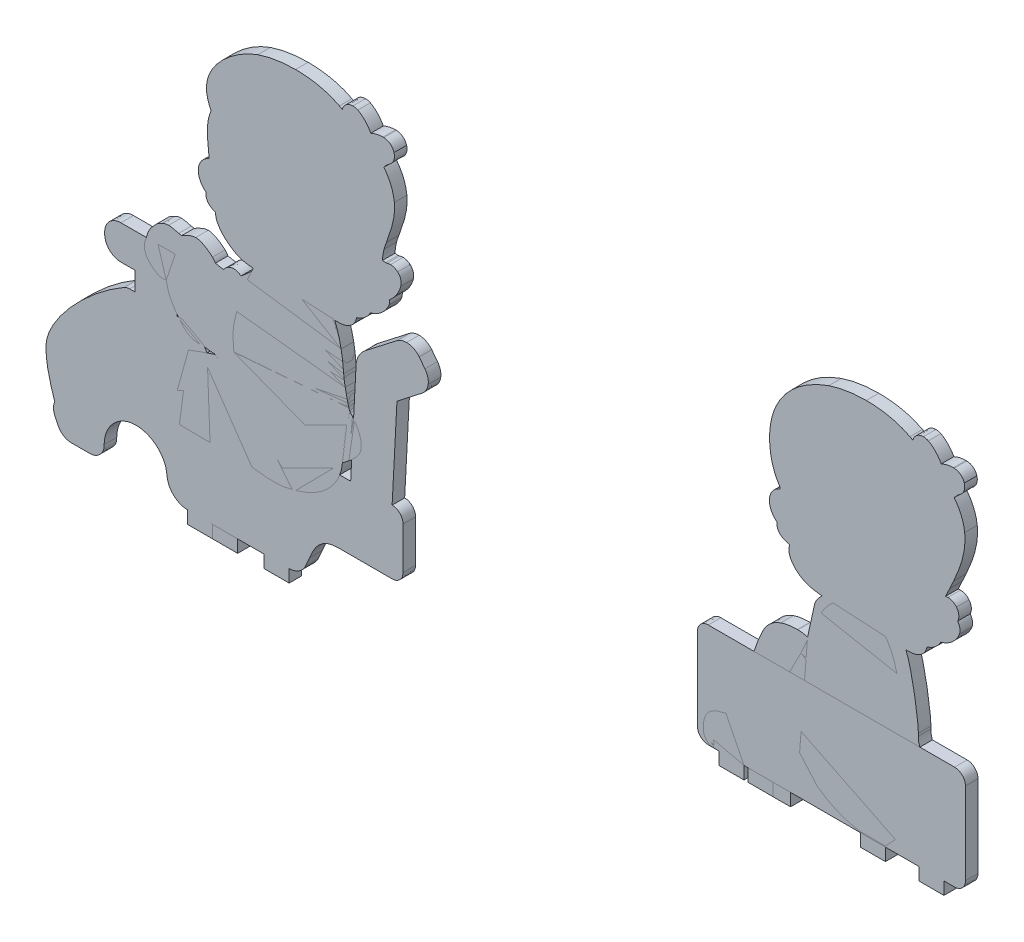
from build123d import *

# Parameters (mm, degrees)
D_TORSO_DEPTH = 2.3
SKETCH10_W    = 4.6
SKETCH10_H    = 2.3
TAB1_DEPTH    = 2.3
D_SIDE_DEPTH  = 2.3
SKETCH15_W    = 4.6
SKETCH15_H    = 2.3
TAB2_DEPTH    = 2.3
M_TORSO_DEPTH = 2.3
SKETCH20_W    = 4.6
SKETCH20_H    = 3.585827138
SKETCH20_H_2  = 2.717243782
TAB3_DEPTH    = 2.3
BOX_DEPTH     = 2.3
SKETCH25_W    = 4.6
SKETCH25_H    = 2.3
TAB4_DEPTH    = 2.3
M_ARM_DEPTH   = 2.3
SKETCH30_W    = 3.45
SKETCH30_H    = 2.3
TAB5_DEPTH    = 2.3


# Sheet-metal steps are written as plain solids
with BuildPart() as part:
    # d-torso: sheet metal written as solids
    # D-middle-laser → d-torso (new body)
    with BuildSketch(Plane.XY):
        with BuildLine():
            Line((303.416944809, -362.651679732), (302.356630546, -361.283503124))
            add(Edge.make_bspline(
                [(302.356630546, -361.283503124), (301.798654269, -360.563478168), (300.956845187, -360.15054041), (300.047081597, -360.15054041)],
                knots=[1, 1, 1, 1, 2, 2, 2, 2], degree=3))
            add(Edge.make_bspline(
                [(300.047081597, -360.15054041), (299.403322442, -360.15054041), (298.768154493, -360.368205849), (298.258560276, -360.763487493)],
                knots=[2, 2, 2, 2, 3, 3, 3, 3], degree=3))
            Line((298.258560276, -360.763487493), (292.42928646, -365.285627486))
            add(Edge.make_bspline(
                [(292.42928646, -365.285627486), (291.461537606, -366.036399919), (290.869670202, -367.16931957), (290.805419171, -368.393964887)],
                knots=[4, 4, 4, 4, 5, 5, 5, 5], degree=3))
            Line((290.805419171, -368.393964887), (290.348577978, -377.102046618))
            add(Edge.make_bspline(
                [(290.348577978, -377.102046618), (290.156212459, -376.850985284), (289.960229589, -376.627140205), (289.771955121, -376.43877961)],
                knots=[6, 6, 6, 6, 7, 7, 7, 7], degree=3))
            add(Edge.make_bspline(
                [(289.771955121, -376.43877961), (289.498586794, -376.131089519), (289.211976382, -374.765023032), (289.022302343, -373.861029977)],
                knots=[7, 7, 7, 7, 8, 8, 8, 8], degree=3))
            add(Edge.make_bspline(
                [(289.022302343, -373.861029977), (288.955510555, -373.542573963), (288.887405323, -373.21830435), (288.814412363, -372.892872018)],
                knots=[8, 8, 8, 8, 9, 9, 9, 9], degree=3))
            add(Edge.make_bspline(
                [(288.814412363, -372.892872018), (288.642028397, -372.124486533), (288.598469471, -371.599798491), (288.538137237, -370.873572363)],
                knots=[9, 9, 9, 9, 10, 10, 10, 10], degree=3))
            add(Edge.make_bspline(
                [(288.538137237, -370.873572363), (288.467491247, -370.022978287), (288.379576717, -368.964386572), (288.067860171, -367.171128245)],
                knots=[10, 10, 10, 10, 11, 11, 11, 11], degree=3))
            add(Edge.make_bspline(
                [(288.067860171, -367.171128245), (287.81216949, -365.700287791), (287.365943498, -364.323842954), (286.892738101, -363.160864845)],
                knots=[11, 11, 11, 11, 12, 12, 12, 12], degree=3))
            add(Edge.make_bspline(
                [(286.892738101, -363.160864845), (287.041566226, -363.179123851), (287.175322058, -363.189889775), (287.291852413, -363.195918692)],
                knots=[12, 12, 12, 12, 13, 13, 13, 13], degree=3))
            add(Edge.make_bspline(
                [(287.291852413, -363.195918692), (287.39406409, -363.201129399), (287.491711015, -363.203584029), (287.585008507, -363.203584029)],
                knots=[13, 13, 13, 13, 14, 14, 14, 14], degree=3))
            add(Edge.make_bspline(
                [(287.585008507, -363.203584029), (289.903256323, -363.203584029), (290.743816557, -361.722192971), (290.875031632, -360.846880335)],
                knots=[14, 14, 14, 14, 15, 15, 15, 15], degree=3))
            add(Edge.make_bspline(
                [(290.875031632, -360.846880335), (290.877529326, -360.830257749), (290.879854765, -360.8135921), (290.881964886, -360.796969514)],
                knots=[15, 15, 15, 15, 16, 16, 16, 16], degree=3))
            add(Edge.make_bspline(
                [(290.881964886, -360.796969514), (292.057689848, -360.441715574), (292.874371265, -359.693096325), (293.271117073, -359.026168903)],
                knots=[16, 16, 16, 16, 17, 17, 17, 17], degree=3))
            add(Edge.make_bspline(
                [(293.271117073, -359.026168903), (293.317970372, -358.947383876), (293.359053136, -358.866079622), (293.394257705, -358.783031289)],
                knots=[17, 17, 17, 17, 18, 18, 18, 18], degree=3))
            add(Edge.make_bspline(
                [(293.394257705, -358.783031289), (293.452759733, -358.766710149), (293.51102491, -358.74980765), (293.569031706, -358.732259194)],
                knots=[18, 18, 18, 18, 19, 19, 19, 19], degree=3))
            add(Edge.make_bspline(
                [(293.569031706, -358.732259194), (296.010097175, -357.993889105), (296.770149835, -356.017889993), (296.848762608, -355.795013847)],
                knots=[19, 19, 19, 19, 20, 20, 20, 20], degree=3))
            add(Edge.make_bspline(
                [(296.848762608, -355.795013847), (296.951318794, -355.504290852), (296.989085653, -355.198517096), (296.962192376, -354.901226887)],
                knots=[20, 20, 20, 20, 21, 21, 21, 21], degree=3))
            add(Edge.make_bspline(
                [(296.962192376, -354.901226887), (298.173358758, -353.909814534), (298.791839525, -352.604166409), (298.989588006, -351.779819655)],
                knots=[21, 21, 21, 21, 22, 22, 22, 22], degree=3))
            add(Edge.make_bspline(
                [(298.989588006, -351.779819655), (299.163156223, -351.056241944), (298.976238261, -350.276832154), (298.418778748, -349.786035238)],
                knots=[22, 22, 22, 22, 23, 23, 23, 23], degree=3))
            add(Edge.make_bspline(
                [(298.418778748, -349.786035238), (298.042509725, -349.454746244), (297.588015503, -349.274589282), (297.119482517, -349.274589282)],
                knots=[23, 23, 23, 23, 24, 24, 24, 24], degree=3))
            add(Edge.make_bspline(
                [(297.119482517, -349.274589282), (296.902549161, -349.274589282), (296.682601346, -349.313238947), (296.466012499, -349.393315885)],
                knots=[24, 24, 24, 24, 25, 25, 25, 25], degree=3))
            add(Edge.make_bspline(
                [(296.466012499, -349.393315885), (296.422668892, -349.402014751), (296.324698989, -349.418228232), (296.19716586, -349.418228232)],
                knots=[25, 25, 25, 25, 26, 26, 26, 26], degree=3))
            add(Edge.make_bspline(
                [(296.19716586, -349.418228232), (296.008503819, -349.418228232), (295.833234586, -349.383626554), (295.674286493, -349.315176813)],
                knots=[26, 26, 26, 26, 27, 27, 27, 27], degree=3))
            add(Edge.make_bspline(
                [(295.674286493, -349.315176813), (295.623040698, -349.010974882), (295.702191766, -348.383859844), (295.910383193, -347.446513958)],
                knots=[27, 27, 27, 27, 28, 28, 28, 28], degree=3))
            add(Edge.make_bspline(
                [(295.910383193, -347.446513958), (295.961198351, -347.217695022), (296.173308574, -346.638832853), (296.360420323, -346.128097448)],
                knots=[28, 28, 28, 28, 29, 29, 29, 29], degree=3))
            add(Edge.make_bspline(
                [(296.360420323, -346.128097448), (297.082253954, -344.158019594), (298.070824104, -341.459906938), (297.813023302, -339.073941464)],
                knots=[29, 29, 29, 29, 30, 30, 30, 30], degree=3))
            add(Edge.make_bspline(
                [(297.813023302, -339.073941464), (297.582589478, -336.941535018), (296.623022726, -335.364757878), (295.896796598, -334.448362479)],
                knots=[30, 30, 30, 30, 31, 31, 31, 31], degree=3))
            add(Edge.make_bspline(
                [(295.896796598, -334.448362479), (296.115194119, -334.12799013), (296.518636333, -333.703037602), (296.948196676, -333.407276155)],
                knots=[31, 31, 31, 31, 32, 32, 32, 32], degree=3))
            add(Edge.make_bspline(
                [(296.948196676, -333.407276155), (297.667618741, -332.923692408), (297.989950487, -332.032683056), (297.752691067, -331.196902892)],
                knots=[32, 32, 32, 32, 33, 33, 33, 33], degree=3))
            add(Edge.make_bspline(
                [(297.752691067, -331.196902892), (297.515431648, -330.361079663), (296.763927131, -329.777135978), (295.898605273, -329.746689947)],
                knots=[33, 33, 33, 33, 34, 34, 34, 34], degree=3))
            add(Edge.make_bspline(
                [(295.898605273, -329.746689947), (295.84109371, -329.744665954), (295.783818998, -329.743675489), (295.726867263, -329.743675489)],
                knots=[34, 34, 34, 34, 35, 35, 35, 35], degree=3))
            add(Edge.make_bspline(
                [(295.726867263, -329.743675489), (294.895048958, -329.743675489), (294.146817282, -329.951264023), (293.4966847, -330.255918124)],
                knots=[35, 35, 35, 35, 36, 36, 36, 36], degree=3))
            add(Edge.make_bspline(
                [(293.4966847, -330.255918124), (292.811132231, -328.944413336), (291.831648521, -328.127452005), (291.131669713, -327.771379855)],
                knots=[36, 36, 36, 36, 37, 37, 37, 37], degree=3))
            add(Edge.make_bspline(
                [(291.131669713, -327.771379855), (290.842776925, -327.624403469), (290.53457007, -327.55457569), (290.230820308, -327.55457569)],
                knots=[37, 37, 37, 37, 38, 38, 38, 38], degree=3))
            add(Edge.make_bspline(
                [(290.230820308, -327.55457569), (289.521819657, -327.554554158), (288.836740888, -327.934806572), (288.475651817, -328.601540208)],
                knots=[38, 38, 38, 38, 39, 39, 39, 39], degree=3))
            add(Edge.make_bspline(
                [(288.475651817, -328.601540208), (288.392474293, -328.755083807), (288.33134538, -328.91495777), (288.29123155, -329.077264831)],
                knots=[39, 39, 39, 39, 40, 40, 40, 40], degree=3))
            Line((288.29123155, -329.077264831), (287.748779734, -328.790805141))
            add(Edge.make_bspline(
                [(287.748779734, -328.790805141), (285.001940508, -327.340419942), (281.870930071, -327.035873501), (279.728059148, -327.035808905)],
                knots=[41, 41, 41, 41, 42, 42, 42, 42], degree=3))
            add(Edge.make_bspline(
                [(279.728059148, -327.035808905), (277.292699617, -327.035722778), (274.840028482, -327.425750651), (272.82180542, -328.13404075)],
                knots=[43, 43, 43, 43, 44, 44, 44, 44], degree=3))
            add(Edge.make_bspline(
                [(272.82180542, -328.13404075), (270.603852946, -328.912503139), (268.229643861, -330.401236557), (266.470728829, -332.116485004)],
                knots=[44, 44, 44, 44, 45, 45, 45, 45], degree=3))
            add(Edge.make_bspline(
                [(266.470728829, -332.116485004), (264.129291214, -334.399786632), (263.100801021, -336.81283917), (263.496448705, -339.09476276)],
                knots=[45, 45, 45, 45, 46, 46, 46, 46], degree=3))
            add(Edge.make_bspline(
                [(263.496448705, -339.09476276), (263.621570267, -339.816510264), (263.879349537, -340.547473398), (264.265781591, -341.278415001)],
                knots=[46, 46, 46, 46, 47, 47, 47, 47], degree=3))
            add(Edge.make_bspline(
                [(264.265781591, -341.278415001), (264.057805483, -341.79349984), (263.851939496, -342.42950753), (263.71615967, -343.159781646)],
                knots=[47, 47, 47, 47, 48, 48, 48, 48], degree=3))
            add(Edge.make_bspline(
                [(263.71615967, -343.159781646), (263.447377626, -344.604934606), (263.658540448, -346.801721274), (263.877540861, -348.747382013)],
                knots=[48, 48, 48, 48, 49, 49, 49, 49], degree=3))
            add(Edge.make_bspline(
                [(263.877540861, -348.747382013), (263.892160985, -348.877434368), (263.905446135, -348.994589146), (263.91647044, -349.095982613)],
                knots=[49, 49, 49, 49, 50, 50, 50, 50], degree=3))
            add(Edge.make_bspline(
                [(263.91647044, -349.095982613), (263.307269899, -349.324930739), (262.774550478, -349.73242094), (262.416260548, -350.267272014)],
                knots=[50, 50, 50, 50, 51, 51, 51, 51], degree=3))
            add(Edge.make_bspline(
                [(262.416260548, -350.267272014), (261.852836713, -351.108305949), (261.766278689, -352.173314155), (262.17878581, -353.189165154)],
                knots=[51, 51, 51, 51, 52, 52, 52, 52], degree=3))
            add(Edge.make_bspline(
                [(262.17878581, -353.189165154), (262.429416506, -353.806397074), (262.818389318, -354.302404697), (263.304578419, -354.648873643)],
                knots=[52, 52, 52, 52, 53, 53, 53, 53], degree=3))
            add(Edge.make_bspline(
                [(263.304578419, -354.648873643), (263.276543954, -354.862060458), (263.282615935, -355.080479512), (263.324624568, -355.295819512)],
                knots=[53, 53, 53, 53, 54, 54, 54, 54], degree=3))
            add(Edge.make_bspline(
                [(263.324624568, -355.295819512), (263.430970359, -355.841048936), (263.758146771, -356.317441046), (264.227971668, -356.611221563)],
                knots=[54, 54, 54, 54, 55, 55, 55, 55], degree=3))
            add(Edge.make_bspline(
                [(264.227971668, -356.611221563), (264.34738729, -356.68591554), (264.634837445, -356.84833026), (265.089568517, -357.002670538)],
                knots=[55, 55, 55, 55, 56, 56, 56, 56], degree=3))
            add(Edge.make_bspline(
                [(265.089568517, -357.002670538), (265.07585273, -357.162135395), (265.081106501, -357.324614711), (265.106664803, -357.486684922)],
                knots=[56, 56, 56, 56, 57, 57, 57, 57], degree=3))
            add(Edge.make_bspline(
                [(265.106664803, -357.486684922), (265.325169984, -358.871031947), (266.620633546, -360.391331053), (268.572086352, -361.553469419)],
                knots=[57, 57, 57, 57, 58, 58, 58, 58], degree=3))
            add(Edge.make_bspline(
                [(268.572086352, -361.553469419), (269.409223023, -362.0520178), (270.544941813, -362.343085304), (271.955751478, -362.421719609)],
                knots=[58, 58, 58, 58, 59, 59, 59, 59], degree=3))
            add(Edge.make_bspline(
                [(271.955751478, -362.421719609), (270.315886027, -365.607528595), (268.728902792, -370.920382598), (268.369148696, -373.403779678)],
                knots=[59, 59, 59, 59, 60, 60, 60, 60], degree=3))
            add(Edge.make_bspline(
                [(268.369148696, -373.403779678), (268.194633078, -374.608572633), (268.28898563, -375.616263063), (268.364777731, -376.425946629)],
                knots=[60, 60, 60, 60, 61, 61, 61, 61], degree=3))
            add(Edge.make_bspline(
                [(268.364777731, -376.425946629), (268.400412937, -376.806457425), (268.448515083, -377.320336481), (268.410877415, -377.506974529)],
                knots=[61, 61, 61, 61, 62, 62, 62, 62], degree=3))
            add(Edge.make_bspline(
                [(268.410877415, -377.506974529), (268.409973077, -377.507792739), (268.408982612, -377.508654013), (268.407992148, -377.509601414)],
                knots=[62, 62, 62, 62, 63, 63, 63, 63], degree=3))
            add(Edge.make_bspline(
                [(268.407992148, -377.509601414), (267.801073982, -378.05112736), (267.385595467, -378.556953505), (267.108286812, -379.018983873)],
                knots=[63, 63, 63, 63, 64, 64, 64, 64], degree=3))
            add(Edge.make_bspline(
                [(267.108286812, -379.018983873), (265.5866312, -379.382872084), (264.389675837, -379.755200779), (263.528660348, -380.056905016)],
                knots=[64, 64, 64, 64, 65, 65, 65, 65], degree=3))
            Line((263.528660348, -380.056905016), (262.5101394, -378.525904582))
            add(Edge.make_bspline(
                [(262.5101394, -378.525904582), (261.883088958, -377.572345215), (260.829578758, -377.00343076), (259.689661258, -377.00343076)],
                knots=[66, 66, 66, 66, 67, 67, 67, 67], degree=3))
            Line((259.689661258, -377.00343076), (258.009811167, -377.00343076))
            Line((258.009811167, -377.00343076), (258.009811167, -373.56539772))
            Line((258.009811167, -373.56539772), (260.323731082, -373.56539772))
            add(Edge.make_bspline(
                [(260.323731082, -373.56539772), (261.956491023, -373.56539772), (263.284833715, -372.237055028), (263.284833715, -370.604295087)],
                knots=[70, 70, 70, 70, 71, 71, 71, 71], degree=3))
            Line((263.284833715, -370.604295087), (263.284833715, -370.287561621))
            add(Edge.make_bspline(
                [(263.284833715, -370.287561621), (263.284833715, -368.654801679), (261.956491023, -367.326458987), (260.323731082, -367.326458987)],
                knots=[72, 72, 72, 72, 73, 73, 73, 73], degree=3))
            Line((260.323731082, -367.326458987), (247.738711147, -367.326458987))
            add(Edge.make_bspline(
                [(247.738711147, -367.326458987), (246.105951205, -367.326458987), (244.777608514, -368.654801679), (244.777608514, -370.287561621)],
                knots=[74, 74, 74, 74, 75, 75, 75, 75], degree=3))
            Line((244.777608514, -370.287561621), (244.777608514, -370.604295087))
            add(Edge.make_bspline(
                [(244.777608514, -370.604295087), (244.777608514, -372.237055028), (246.105951205, -373.56539772), (247.738711147, -373.56539772)],
                knots=[76, 76, 76, 76, 77, 77, 77, 77], degree=3))
            Line((247.738711147, -373.56539772), (250.321090127, -373.56539772))
            Line((250.321090127, -373.56539772), (250.321090127, -377.00343076))
            Line((250.321090127, -377.00343076), (249.34677406, -377.00343076))
            add(Edge.make_bspline(
                [(249.34677406, -377.00343076), (248.998905543, -377.00343076), (248.657065944, -377.094639663), (248.35516792, -377.26810022)],
                knots=[80, 80, 80, 80, 81, 81, 81, 81], degree=3))
            add(Edge.make_bspline(
                [(248.35516792, -377.26810022), (241.237363797, -381.357514689), (234.56791732, -388.778422619), (234.082524898, -393.148913815)],
                knots=[81, 81, 81, 81, 82, 82, 82, 82], degree=3))
            add(Edge.make_bspline(
                [(234.082524898, -393.148913815), (233.775179317, -395.916229827), (234.956330304, -399.80574263), (235.642378006, -401.768069018)],
                knots=[82, 82, 82, 82, 83, 83, 83, 83], degree=3))
            add(Edge.make_bspline(
                [(235.642378006, -401.768069018), (235.313651302, -402.49188358), (235.323276037, -403.321979337), (235.681329117, -404.048808357)],
                knots=[83, 83, 83, 83, 84, 84, 84, 84], degree=3))
            Line((235.681329117, -404.048808357), (236.284328486, -405.272592401))
            add(Edge.make_bspline(
                [(236.284328486, -405.272592401), (236.735679059, -406.18864329), (237.649016935, -406.757686937), (238.667860862, -406.757686937)],
                knots=[85, 85, 85, 85, 86, 86, 86, 86], degree=3))
            Line((238.667860862, -406.757686937), (242.023319269, -406.757686937))
            add(Edge.make_bspline(
                [(242.023319269, -406.757686937), (242.83935473, -406.757686937), (243.570705438, -406.38708079), (244.058789341, -405.804859653)],
                knots=[87, 87, 87, 87, 88, 88, 88, 88], degree=3))
            add(Edge.make_bspline(
                [(244.058789341, -405.804859653), (244.447525302, -405.341149801), (244.681942518, -404.856597121), (244.681942518, -404.035286357)],
                knots=[88, 88, 88, 88, 89, 89, 89, 89], degree=3))
            add(Edge.make_bspline(
                [(244.681942518, -404.035286357), (244.721001288, -400.714472692), (247.343278781, -398.041982933), (250.493452561, -398.041982933)],
                knots=[89, 89, 89, 89, 90, 90, 90, 90], degree=3))
            add(Edge.make_bspline(
                [(250.493452561, -398.041982933), (252.901036009, -398.04521271), (255.015571022, -399.500593297), (255.888041453, -401.705540535)],
                knots=[90, 90, 90, 90, 91, 91, 91, 91], degree=3))
            add(Edge.make_bspline(
                [(255.888041453, -401.705540535), (256.026254378, -402.057327848), (256.190413178, -403.165227493)],
                knots=[91, 91, 91, 92, 92, 92], degree=2))
            add(Edge.make_bspline(
                [(256.190413178, -403.165227493), (256.333169322, -405.170186938), (258.00658139, -406.757686937), (260.042998863, -406.757686937)],
                knots=[92, 92, 92, 92, 93, 93, 93, 93], degree=3))
            Line((260.042998863, -406.757686937), (278.53851074, -406.757686937))
            add(Edge.make_bspline(
                [(278.53851074, -406.757686937), (279.79267622, -406.757686937), (280.928244287, -406.067332866), (281.50202494, -404.955988126)],
                knots=[94, 94, 94, 94, 95, 95, 95, 95], degree=3))
            add(Edge.make_bspline(
                [(281.50202494, -404.955988126), (281.780733165, -404.416227791), (282.046823728, -403.817470195), (282.292911205, -403.176467117)],
                knots=[95, 95, 95, 95, 96, 96, 96, 96], degree=3))
            add(Edge.make_bspline(
                [(282.292911205, -403.176467117), (283.760048181, -399.289495072), (285.88304521, -398.965182395), (287.932144941, -398.965182395)],
                knots=[96, 96, 96, 96, 97, 97, 97, 97], degree=3))
            Line((287.932144941, -398.965182395), (297.407987732, -398.965182395))
            add(Edge.make_bspline(
                [(297.407987732, -398.965182395), (298.51033216, -398.965182395), (299.403968397, -398.068294849), (299.403968397, -396.961902434)],
                knots=[98, 98, 98, 98, 99, 99, 99, 99], degree=3))
            Line((299.403968397, -396.961902434), (299.403968397, -389.277057127))
            add(Edge.make_bspline(
                [(299.403968397, -389.277057127), (299.403968397, -388.170664711), (298.51033216, -387.273777166), (297.407987732, -387.273777166)],
                knots=[100, 100, 100, 100, 101, 101, 101, 101], degree=3))
            Line((297.407987732, -387.273777166), (297.403573704, -387.273777166))
            Line((297.403573704, -387.273777166), (298.29195617, -370.341908002))
            Line((298.29195617, -370.341908002), (302.897316751, -366.769214793))
            add(Edge.make_bspline(
                [(302.897316751, -366.769214793), (303.5160559, -366.289226864), (303.910820779, -365.596288971), (304.008919873, -364.818128028)],
                knots=[104, 104, 104, 104, 105, 105, 105, 105], degree=3))
            add(Edge.make_bspline(
                [(304.008919873, -364.818128028), (304.106997435, -364.040225468), (303.896738951, -363.270849519), (303.416944809, -362.651679732)],
                knots=[105, 105, 105, 105, 106, 106, 106, 106], degree=3))
        make_face()
        with BuildLine():
            Line((289.814954219, -387.273777166), (287.751320491, -387.273777166))
            add(Edge.make_bspline(
                [(287.751320491, -387.273777166), (288.001714338, -386.492601764), (288.140594749, -385.743594942), (288.217592634, -385.159995767)],
                knots=[1, 1, 1, 1, 2, 2, 2, 2], degree=3))
            add(Edge.make_bspline(
                [(288.217592634, -385.159995767), (288.778863284, -384.778236123), (289.421050614, -384.296784029), (289.998470149, -383.7752827)],
                knots=[2, 2, 2, 2, 3, 3, 3, 3], degree=3))
            Line((289.998470149, -383.7752827), (289.814954219, -387.273777166))
        make_face(mode=Mode.SUBTRACT)
    extrude(amount=-D_TORSO_DEPTH)

    # Tab1: sheet metal written as solids
    # Sketch10 → Tab1 (add)
    with BuildSketch(Plane.XY):
        with Locations((262.25843388, -407.907686937)):
            Rectangle(SKETCH10_W, SKETCH10_H)
        with Locations((276.25843388, -407.907686937)):
            Rectangle(SKETCH10_W, SKETCH10_H)
    extrude(amount=-TAB1_DEPTH)


with BuildPart() as body_2:
    # d-side: sheet metal written as solids
    # D-side-laser → d-side (new body)
    with BuildSketch(Plane.XY):
        with BuildLine():
            Line((258.872397146, -363.795578641), (258.340446595, -363.712963676))
            add(Edge.make_bspline(
                [(258.340446595, -363.712963676), (257.102172757, -363.356215382), (256.632698326, -363.356215382), (256.475502968, -363.356215382)],
                knots=[8, 8, 8, 8, 9, 9, 9, 9], degree=3))
            add(Edge.make_bspline(
                [(256.475502968, -363.356215382), (256.009003058, -363.35446041), (255.553436381, -363.502578837), (255.181961013, -363.763135862)],
                knots=[9, 9, 9, 9, 10, 10, 10, 10], degree=3))
            add(Edge.make_bspline(
                [(255.181961013, -363.763135862), (254.61935208, -363.947490852), (254.137386149, -364.308582381), (253.796684542, -364.788996088)],
                knots=[10, 10, 10, 10, 11, 11, 11, 11], degree=3))
            add(Edge.make_bspline(
                [(253.796684542, -364.788996088), (253.112631486, -365.335540723), (252.561980801, -366.509985051), (252.363347956, -367.554213129)],
                knots=[11, 11, 11, 11, 12, 12, 12, 12], degree=3))
            add(Edge.make_bspline(
                [(252.363347956, -367.554213129), (251.292298247, -369.601129513), (253.084159031, -371.313241657), (254.113075303, -371.91607939)],
                knots=[12, 12, 12, 12, 13, 13, 13, 13], degree=3))
            add(Edge.make_bspline(
                [(254.113075303, -371.91607939), (254.794385244, -372.323972969), (255.361618749, -372.472065776), (256.043631973, -372.294282429)],
                knots=[13, 13, 13, 13, 14, 14, 14, 14], degree=3))
            add(Edge.make_bspline(
                [(256.043631973, -372.294282429), (256.310734133, -373.710026601), (256.813020202, -375.173008438), (257.730121712, -376.292814147)],
                knots=[14, 14, 14, 14, 15, 15, 15, 15], degree=3))
            add(Edge.make_bspline(
                [(257.730121712, -376.292814147), (258.497979568, -377.192653975), (259.081240118, -378.196938842), (259.942517788, -378.7705408)],
                knots=[15, 15, 15, 15, 16, 16, 16, 16], degree=3))
            add(Edge.make_bspline(
                [(259.942517788, -378.7705408), (260.701869281, -379.27216983), (261.5153583, -379.339786124), (262.210960953, -379.339786124)],
                knots=[16, 16, 16, 16, 17, 17, 17, 17], degree=3))
            add(Edge.make_bspline(
                [(262.210960953, -379.339786124), (262.817976246, -379.339786124), (263.929003467, -379.435932499), (265.041776853, -379.568067535)],
                knots=[17, 17, 17, 17, 18, 18, 18, 18], degree=3))
            add(Edge.make_bspline(
                [(265.041776853, -379.568067535), (263.479630225, -380.029561986), (262.850723669, -380.306968395), (262.360517171, -380.482783945)],
                knots=[18, 18, 18, 18, 19, 19, 19, 19], degree=3))
            add(Edge.make_bspline(
                [(262.360517171, -380.482783945), (260.282574516, -381.193217879), (259.133330439, -381.652890954), (258.722514931, -382.190846024)],
                knots=[19, 19, 19, 19, 20, 20, 20, 20], degree=3))
            add(Edge.make_bspline(
                [(258.722514931, -382.190846024), (257.20038636, -383.790652427), (255.644784401, -385.661685175), (255.760676668, -387.675462928)],
                knots=[20, 20, 20, 20, 21, 21, 21, 21], degree=3))
            add(Edge.make_bspline(
                [(255.760676668, -387.675462928), (255.867797332, -389.612775698), (256.133904584, -391.135833734), (257.084365946, -392.271575533)],
                knots=[21, 21, 21, 21, 22, 22, 22, 22], degree=3))
            add(Edge.make_bspline(
                [(257.084365946, -392.271575533), (257.285702702, -392.51196185), (257.755583218, -393.090348122), (258.457865963, -393.961982878)],
                knots=[22, 22, 22, 22, 23, 23, 23, 23], degree=3))
            add(Edge.make_bspline(
                [(258.457865963, -393.961982878), (257.930741372, -396.086078132), (258.835917618, -397.102047436), (260.265632875, -397.998581877)],
                knots=[23, 23, 23, 23, 24, 24, 24, 24], degree=3))
            add(Edge.make_bspline(
                [(260.265632875, -397.998581877), (260.369387496, -398.137238074), (260.55017637, -398.490440486), (260.642946402, -398.740282488)],
                knots=[24, 24, 24, 24, 25, 25, 25, 25], degree=3))
            add(Edge.make_bspline(
                [(260.642946402, -398.740282488), (261.209875025, -400.259574159), (262.875440397, -400.164932984), (264.322499466, -399.979425454)],
                knots=[25, 25, 25, 25, 26, 26, 26, 26], degree=3))
            Line((264.322499466, -399.979425454), (264.887586522, -400.562131996))
            add(Edge.make_bspline(
                [(264.887586522, -400.562131996), (264.876114631, -400.864224805), (264.860967675, -401.133752563), (264.845150679, -401.351600116)],
                knots=[27, 27, 27, 27, 28, 28, 28, 28], degree=3))
            add(Edge.make_bspline(
                [(264.845150679, -401.351600116), (263.430338911, -401.96024249), (263.109530454, -403.263240278), (263.049723659, -404.357047591)],
                knots=[28, 28, 28, 28, 29, 29, 29, 29], degree=3))
            add(Edge.make_bspline(
                [(263.049723659, -404.357047591), (263.001341567, -405.241908361), (263.287078244, -406.147201915), (264.116888391, -406.604878935)],
                knots=[29, 29, 29, 29, 30, 30, 30, 30], degree=3))
            add(Edge.make_bspline(
                [(264.116888391, -406.604878935), (264.203538156, -406.661659444), (264.310476644, -406.712599047), (264.434195613, -406.757853518)],
                knots=[30, 30, 30, 30, 31, 31, 31, 31], degree=3))
            Line((264.434195613, -406.757853518), (269.137586815, -406.757772651))
            add(Edge.make_bspline(
                [(269.137586815, -406.757772651), (269.556913154, -406.643398105), (269.785512137, -406.504655605), (270.011173306, -406.318505513)],
                knots=[32, 32, 32, 32, 33, 33, 33, 33], degree=3))
            add(Edge.make_bspline(
                [(270.011173306, -406.318505513), (270.694394242, -405.754909925), (271.096364494, -404.643678371), (271.619799516, -403.843009885)],
                knots=[33, 33, 33, 33, 34, 34, 34, 34], degree=3))
            add(Edge.make_bspline(
                [(271.619799516, -403.843009885), (274.380082617, -402.39542121), (273.859011699, -399.252989356), (271.778172518, -397.549885205)],
                knots=[34, 34, 34, 34, 35, 35, 35, 35], degree=3))
            Line((271.778172518, -397.549885205), (271.168172503, -396.180971124))
            add(Edge.make_bspline(
                [(271.168172503, -396.180971124), (271.55056252, -395.46553604), (271.790347913, -394.805938132), (271.732508302, -394.069948859)],
                knots=[36, 36, 36, 36, 37, 37, 37, 37], degree=3))
            add(Edge.make_bspline(
                [(271.732508302, -394.069948859), (273.88580142, -394.364785311), (275.621007018, -394.52101491), (277.517405963, -394.295481162)],
                knots=[37, 37, 37, 37, 38, 38, 38, 38], degree=3))
            add(Edge.make_bspline(
                [(277.517405963, -394.295481162), (284.51411226, -393.074010998), (287.940203407, -389.217208572), (288.3042126, -385.101436138)],
                knots=[38, 38, 38, 38, 39, 39, 39, 39], degree=3))
            add(Edge.make_bspline(
                [(288.3042126, -385.101436138), (289.412965748, -384.337033733), (290.82871887, -383.182054508), (291.406089985, -382.122773329)],
                knots=[39, 39, 39, 39, 40, 40, 40, 40], degree=3))
            add(Edge.make_bspline(
                [(291.406089985, -382.122773329), (292.446214832, -380.214110858), (290.955843661, -377.623538676), (289.772106988, -376.438928923)],
                knots=[40, 40, 40, 40, 41, 41, 41, 41], degree=3))
            add(Edge.make_bspline(
                [(289.772106988, -376.438928923), (289.360991342, -375.871352456), (289.054644482, -373.883183799), (288.814254345, -372.892357973)],
                knots=[41, 41, 41, 41, 42, 42, 42, 42], degree=3))
            add(Edge.make_bspline(
                [(288.814254345, -372.892357973), (288.385386538, -370.678365432), (288.588190274, -369.981235925), (288.067737839, -367.171102485)],
                knots=[42, 42, 42, 42, 43, 43, 43, 43], degree=3))
            add(Edge.make_bspline(
                [(288.067737839, -367.171102485), (287.429932713, -363.50021078), (285.413229012, -361.625957626), (284.941866287, -360.97594047)],
                knots=[43, 43, 43, 43, 44, 44, 44, 44], degree=3))
            add(Edge.make_bspline(
                [(284.941866287, -360.97594047), (284.819260833, -360.628471203), (284.276915253, -359.912923043), (283.73194671, -359.442080556)],
                knots=[44, 44, 44, 44, 45, 45, 45, 45], degree=3))
            add(Edge.make_bspline(
                [(283.73194671, -359.442080556), (283.311019249, -359.081440044), (282.605772307, -359.113922017)],
                knots=[45, 45, 45, 46, 46, 46], degree=2))
            add(Edge.make_bspline(
                [(282.605772307, -359.113922017), (282.107222216, -359.113922017), (281.662947649, -359.143891723), (280.902777541, -359.375820909)],
                knots=[0, 0, 0, 0, 1, 1, 1, 1], degree=3))
            add(Edge.make_bspline(
                [(280.902777541, -359.375820909), (271.588289586, -360.747860342), (274.754006955, -360.734792281), (269.723440936, -364.779208584)],
                knots=[1, 1, 1, 1, 2, 2, 2, 2], degree=3))
            add(Edge.make_bspline(
                [(269.723440936, -364.779208584), (268.729495671, -363.9377214), (267.410421226, -364.174392622), (266.557304967, -365.323649821)],
                knots=[2, 2, 2, 2, 3, 3, 3, 3], degree=3))
            add(Edge.make_bspline(
                [(266.557304967, -365.323649821), (266.001832387, -365.28688041), (266.252058122, -365.327222346), (265.051482275, -365.078128088)],
                knots=[3, 3, 3, 3, 4, 4, 4, 4], degree=3))
            add(Edge.make_bspline(
                [(265.051482275, -365.078128088), (264.923261056, -364.826533524), (264.747284285, -364.595969706), (264.52627273, -364.398663812)],
                knots=[4, 4, 4, 4, 5, 5, 5, 5], degree=3))
            add(Edge.make_bspline(
                [(264.52627273, -364.398663812), (264.1268682, -364.035394357), (262.68900377, -362.816385477), (261.436192103, -362.816140934)],
                knots=[5, 5, 5, 5, 6, 6, 6, 6], degree=3))
            add(Edge.make_bspline(
                [(261.436192103, -362.816140934), (260.662749573, -362.831743514), (259.83594122, -363.270833806), (258.872397146, -363.795578641)],
                knots=[6, 6, 6, 6, 7, 7, 7, 7], degree=3))
        make_face()
    extrude(amount=-D_SIDE_DEPTH)

    # Tab2: sheet metal written as solids
    # Sketch15 → Tab2 (add)
    with BuildSketch(Plane.XY):
        with Locations((266.821151731, -407.907847595)):
            Rectangle(SKETCH15_W, SKETCH15_H)
    extrude(amount=-TAB2_DEPTH)


with BuildPart() as body_3:
    # m-torso: sheet metal written as solids
    # M-middle-laser → m-torso (new body)
    with BuildSketch(Plane.XY):
        with BuildLine():
            Line((371.69509739, -369.890580554), (371.611885837, -369.891106441))
            add(Edge.make_bspline(
                [(371.611885837, -369.891106441), (370.143284853, -369.914973634), (369.407103303, -370.076906472), (368.560404513, -370.367398529)],
                knots=[19, 19, 19, 19, 20, 20, 20, 20], degree=3))
            add(Edge.make_bspline(
                [(368.560404513, -370.367398529), (367.094615004, -370.871239022), (366.017051686, -371.823175953), (365.265316007, -373.27786115)],
                knots=[20, 20, 20, 20, 21, 21, 21, 21], degree=3))
            add(Edge.make_bspline(
                [(365.265316007, -373.27786115), (364.478952672, -374.798969958), (363.579280849, -377.316716119), (362.858754559, -380.012616718)],
                knots=[21, 21, 21, 21, 22, 22, 22, 22], degree=3))
            add(Edge.make_bspline(
                [(362.858754559, -380.012616718), (361.951032615, -383.40774517), (361.458741416, -386.244988096), (361.368855139, -386.78450802)],
                knots=[22, 22, 22, 22, 23, 23, 23, 23], degree=3))
            add(Edge.make_bspline(
                [(361.368855139, -386.78450802), (361.308843307, -387.082483859), (361.232528968, -387.609746563), (361.282285998, -388.202462011)],
                knots=[23, 23, 23, 23, 24, 24, 24, 24], degree=3))
            add(Edge.make_bspline(
                [(361.282285998, -388.202462011), (360.081483012, -388.985831834), (358.682460965, -389.735625774), (357.635196846, -389.955770292)],
                knots=[24, 24, 24, 24, 25, 25, 25, 25], degree=3))
            add(Edge.make_bspline(
                [(357.635196846, -389.955770292), (354.737173484, -390.564505076), (354.270064196, -392.738725466), (354.388591105, -394.455464353)],
                knots=[25, 25, 25, 25, 26, 26, 26, 26], degree=3))
            add(Edge.make_bspline(
                [(354.388591105, -394.455464353), (354.461709667, -395.509221157), (355.345766683, -396.334216983), (356.401303413, -396.334216983)],
                knots=[26, 26, 26, 26, 27, 27, 27, 27], degree=3))
            Line((356.401303413, -396.334216983), (367.366175118, -396.33712959))
            add(Edge.make_bspline(
                [(367.366175118, -396.33712959), (367.681768182, -396.33712959), (367.99693649, -396.261887252), (368.278003029, -396.119533603)],
                knots=[28, 28, 28, 28, 29, 29, 29, 29], degree=3))
            add(Edge.make_bspline(
                [(368.278003029, -396.119533603), (369.175996058, -395.666582821), (370.576454183, -394.26201873), (370.11448241, -391.878495191)],
                knots=[29, 29, 29, 29, 30, 30, 30, 30], degree=3))
            Line((370.11448241, -391.878495191), (369.993629462, -391.254550128))
            add(Edge.make_bspline(
                [(369.993629462, -391.254550128), (370.247835295, -391.002205126), (370.526009454, -390.707991405), (370.846942296, -390.361108047)],
                knots=[31, 31, 31, 31, 32, 32, 32, 32], degree=3))
            add(Edge.make_bspline(
                [(370.846942296, -390.361108047), (371.084036566, -390.104920022), (371.323234385, -389.846426185), (371.475519213, -389.701847628)],
                knots=[32, 32, 32, 32, 33, 33, 33, 33], degree=3))
            add(Edge.make_bspline(
                [(371.475519213, -389.701847628), (371.604907717, -389.578830451), (371.761359191, -389.434858688), (371.931544414, -389.278467893)],
                knots=[33, 33, 33, 33, 34, 34, 34, 34], degree=3))
            add(Edge.make_bspline(
                [(371.931544414, -389.278467893), (371.957838779, -389.254277077), (371.983829748, -389.230328978), (372.009618452, -389.206542691)],
                knots=[34, 34, 34, 34, 35, 35, 35, 35], degree=3))
            add(Edge.make_bspline(
                [(372.009618452, -389.206542691), (372.575250704, -390.256537378), (373.111797342, -391.029146738), (373.613048851, -391.51381257)],
                knots=[35, 35, 35, 35, 36, 36, 36, 36], degree=3))
            add(Edge.make_bspline(
                [(373.613048851, -391.51381257), (376.855447494, -394.648141372), (380.941328924, -396.304767294), (385.429150068, -396.304767294)],
                knots=[36, 36, 36, 36, 37, 37, 37, 37], degree=3))
            add(Edge.make_bspline(
                [(385.429150068, -396.304767294), (390.985978748, -396.304767294), (394.70784503, -394.076259152), (395.90913345, -390.02975859)],
                knots=[37, 37, 37, 37, 38, 38, 38, 38], degree=3))
            add(Edge.make_bspline(
                [(395.90913345, -390.02975859), (396.733603388, -387.251010514), (397.248527967, -384.585894549), (395.189861199, -380.098134084)],
                knots=[38, 38, 38, 38, 39, 39, 39, 39], degree=3))
            add(Edge.make_bspline(
                [(395.189861199, -380.098134084), (393.741405745, -376.940747147), (393.746725297, -376.61360479), (393.760924254, -375.73921601)],
                knots=[39, 39, 39, 39, 40, 40, 40, 40], degree=3))
            add(Edge.make_bspline(
                [(393.760924254, -375.73921601), (393.7633312, -375.595891492), (393.765677467, -375.441766058), (393.765677467, -375.272187628)],
                knots=[40, 40, 40, 40, 41, 41, 41, 41], degree=3))
            add(Edge.make_bspline(
                [(393.765677467, -375.272187628), (393.765677467, -373.56782732), (392.723126107, -366.10314017), (391.472707677, -363.135194022)],
                knots=[41, 41, 41, 41, 42, 42, 42, 42], degree=3))
            add(Edge.make_bspline(
                [(391.472707677, -363.135194022), (391.576044533, -363.14587358), (391.670340172, -363.152831473), (391.754421462, -363.157119477)],
                knots=[42, 42, 42, 42, 43, 43, 43, 43], degree=3))
            add(Edge.make_bspline(
                [(391.754421462, -363.157119477), (391.855674995, -363.162216539), (391.952053957, -363.1644819), (392.044326953, -363.1644819)],
                knots=[43, 43, 43, 43, 44, 44, 44, 44], degree=3))
            add(Edge.make_bspline(
                [(392.044326953, -363.1644819), (394.345265958, -363.1644819), (395.187616065, -361.699804845), (395.322587065, -360.834396602)],
                knots=[44, 44, 44, 44, 45, 45, 45, 45], degree=3))
            add(Edge.make_bspline(
                [(395.322587065, -360.834396602), (395.325256954, -360.816354622), (395.327684126, -360.798353095), (395.329888808, -360.780351568)],
                knots=[45, 45, 45, 45, 46, 46, 46, 46], degree=3))
            add(Edge.make_bspline(
                [(395.329888808, -360.780351568), (396.503628824, -360.427683449), (397.31812713, -359.680114416), (397.713048271, -359.014421992)],
                knots=[46, 46, 46, 46, 47, 47, 47, 47], degree=3))
            add(Edge.make_bspline(
                [(397.713048271, -359.014421992), (397.758881372, -358.937642445), (397.799051072, -358.858314367), (397.833577596, -358.777044552)],
                knots=[47, 47, 47, 47, 48, 48, 48, 48], degree=3))
            add(Edge.make_bspline(
                [(397.833577596, -358.777044552), (397.89227471, -358.760822951), (397.95048639, -358.74403501), (398.008253088, -358.726599823)],
                knots=[48, 48, 48, 48, 49, 49, 49, 49], degree=3))
            add(Edge.make_bspline(
                [(398.008253088, -358.726599823), (400.442443846, -357.993027483), (401.197173037, -356.030699224), (401.275226849, -355.809381574)],
                knots=[49, 49, 49, 49, 50, 50, 50, 50], degree=3))
            add(Edge.make_bspline(
                [(401.275226849, -355.809381574), (401.505626169, -355.160841166), (401.379736838, -354.43479306), (400.946810226, -353.898590271)],
                knots=[50, 50, 50, 50, 51, 51, 51, 51], degree=3))
            add(Edge.make_bspline(
                [(400.946810226, -353.898590271), (401.290416902, -353.221692402), (401.215579093, -352.387068793), (400.743514329, -351.778819443)],
                knots=[51, 51, 51, 51, 52, 52, 52, 52], degree=3))
            add(Edge.make_bspline(
                [(400.743514329, -351.778819443), (400.370174794, -351.297713463), (399.782576635, -351.010356503), (399.171798981, -351.010275597)],
                knots=[52, 52, 52, 52, 53, 53, 53, 53], degree=3))
            add(Edge.make_bspline(
                [(399.171798981, -351.010275597), (399.027989029, -351.010275597), (398.885048813, -351.02574882), (398.745081884, -351.056412095)],
                knots=[53, 53, 53, 53, 54, 54, 54, 54], degree=3))
            add(Edge.make_bspline(
                [(398.745081884, -351.056412095), (398.947366459, -350.550650091), (399.265973261, -349.899217303), (399.487432497, -349.446448558)],
                knots=[54, 54, 54, 54, 55, 55, 55, 55], degree=3))
            add(Edge.make_bspline(
                [(399.487432497, -349.446448558), (399.738887535, -348.931989187), (399.991535933, -348.415062191), (400.221571177, -347.887860166)],
                knots=[55, 55, 55, 55, 56, 56, 56, 56], degree=3))
            add(Edge.make_bspline(
                [(400.221571177, -347.887860166), (401.220170493, -345.600877401), (402.588064058, -342.468146488), (402.235254354, -339.215230099)],
                knots=[56, 56, 56, 56, 57, 57, 57, 57], degree=3))
            add(Edge.make_bspline(
                [(402.235254354, -339.215230099), (402.0061293, -337.102578976), (401.042804886, -335.530802948), (400.325899128, -334.626175648)],
                knots=[57, 57, 57, 57, 58, 58, 58, 58], degree=3))
            add(Edge.make_bspline(
                [(400.325899128, -334.626175648), (400.542949001, -334.307912695), (400.945333696, -333.886838774), (401.376338797, -333.589307917)],
                knots=[58, 58, 58, 58, 59, 59, 59, 59], degree=3))
            add(Edge.make_bspline(
                [(401.376338797, -333.589307917), (402.090736477, -333.097926908), (402.405823879, -332.222526807), (402.170003875, -331.39821868)],
                knots=[60, 60, 60, 60, 61, 61, 61, 61], degree=3))
            add(Edge.make_bspline(
                [(402.170003875, -331.39821868), (401.93248485, -330.567013339), (401.192197334, -329.987930508), (400.328022904, -329.957732441)],
                knots=[61, 61, 61, 61, 62, 62, 62, 62], degree=3))
            add(Edge.make_bspline(
                [(400.328022904, -329.957732441), (400.270235979, -329.955891835), (400.217991098, -329.955082778), (400.166272104, -329.955082778)],
                knots=[62, 62, 62, 62, 63, 63, 63, 63], degree=3))
            add(Edge.make_bspline(
                [(400.166272104, -329.955082778), (399.419876204, -329.955022098), (398.668565281, -330.129798722), (397.946238838, -330.463534898)],
                knots=[63, 63, 63, 63, 64, 64, 64, 64], degree=3))
            add(Edge.make_bspline(
                [(397.946238838, -330.463534898), (397.075167194, -328.804279539), (395.777540265, -328.097729716), (395.580251619, -327.997608863)],
                knots=[64, 64, 64, 64, 65, 65, 65, 65], degree=3))
            add(Edge.make_bspline(
                [(395.580251619, -327.997608863), (395.300762742, -327.856448574), (394.990873533, -327.782601861), (394.681227041, -327.782601861)],
                knots=[65, 65, 65, 65, 66, 66, 66, 66], degree=3))
            add(Edge.make_bspline(
                [(394.681227041, -327.782601861), (393.953581047, -327.782520955), (393.284571487, -328.179141116), (392.935463221, -328.817669439)],
                knots=[66, 66, 66, 66, 67, 67, 67, 67], degree=3))
            add(Edge.make_bspline(
                [(392.935463221, -328.817669439), (392.851907818, -328.971774646), (392.79033855, -329.131523029), (392.749764322, -329.293253602)],
                knots=[67, 67, 67, 67, 68, 68, 68, 68], degree=3))
            Line((392.749764322, -329.293253602), (392.209637605, -329.009092419))
            add(Edge.make_bspline(
                [(392.209637605, -329.009092419), (389.47213123, -327.568788217), (386.354792634, -327.26638279), (384.221733038, -327.266342337)],
                knots=[69, 69, 69, 69, 70, 70, 70, 70], degree=3))
            add(Edge.make_bspline(
                [(384.221733038, -327.266342337), (381.795511495, -327.266301884), (379.351470463, -327.653719018), (377.33980993, -328.357214649)],
                knots=[1, 1, 1, 1, 2, 2, 2, 2], degree=3))
            add(Edge.make_bspline(
                [(377.33980993, -328.357214649), (375.471999801, -329.010366684), (372.769626743, -330.253867674), (370.502890639, -332.468601613)],
                knots=[2, 2, 2, 2, 3, 3, 3, 3], degree=3))
            add(Edge.make_bspline(
                [(370.502890639, -332.468601613), (367.633487682, -335.272207978), (366.26796061, -338.930947557), (366.553921947, -343.049272188)],
                knots=[3, 3, 3, 3, 4, 4, 4, 4], degree=3))
            add(Edge.make_bspline(
                [(366.553921947, -343.049272188), (366.622246844, -344.029445222), (366.797650487, -346.546705949), (368.439854961, -348.90531052)],
                knots=[4, 4, 4, 4, 5, 5, 5, 5], degree=3))
            add(Edge.make_bspline(
                [(368.439854961, -348.90531052), (368.450595198, -349.000334311), (368.460303887, -349.086418017), (368.468657404, -349.162934621)],
                knots=[5, 5, 5, 5, 6, 6, 6, 6], degree=3))
            add(Edge.make_bspline(
                [(368.468657404, -349.162934621), (367.98882569, -349.342686947), (367.553997793, -349.633138552), (367.218158068, -350.010402016)],
                knots=[6, 6, 6, 6, 7, 7, 7, 7], degree=3))
            add(Edge.make_bspline(
                [(367.218158068, -350.010402016), (366.449068108, -350.875466409), (366.269639404, -352.07691664), (366.737517296, -353.225090443)],
                knots=[7, 7, 7, 7, 8, 8, 8, 8], degree=3))
            add(Edge.make_bspline(
                [(366.737517296, -353.225090443), (366.987516031, -353.838720024), (367.375115203, -354.331880959), (367.859336054, -354.676498957)],
                knots=[8, 8, 8, 8, 9, 9, 9, 9], degree=3))
            add(Edge.make_bspline(
                [(367.859336054, -354.676498957), (367.831605611, -354.887582031), (367.837491504, -355.10351945), (367.878915242, -355.315573393)],
                knots=[9, 9, 9, 9, 10, 10, 10, 10], degree=3))
            add(Edge.make_bspline(
                [(367.878915242, -355.315573393), (367.984618591, -355.855619204), (368.312893629, -356.331628123), (368.77963884, -356.62212018)],
                knots=[10, 10, 10, 10, 11, 11, 11, 11], degree=3))
            add(Edge.make_bspline(
                [(368.77963884, -356.62212018), (368.942502094, -356.723697336), (369.423830565, -356.991212164), (370.222208402, -357.175272721)],
                knots=[11, 11, 11, 11, 12, 12, 12, 12], degree=3))
            add(Edge.make_bspline(
                [(370.222208402, -357.175272721), (370.057403411, -357.527293594), (369.993063122, -357.928869232), (370.056533674, -358.330121247)],
                knots=[12, 12, 12, 12, 13, 13, 13, 13], degree=3))
            add(Edge.make_bspline(
                [(370.056533674, -358.330121247), (370.327911751, -360.044594773), (372.17761922, -361.457047173), (373.780240561, -361.915742263)],
                knots=[13, 13, 13, 13, 14, 14, 14, 14], degree=3))
            add(Edge.make_bspline(
                [(373.780240561, -361.915742263), (374.504812138, -362.122618239), (375.339860502, -362.236938049), (376.134638034, -362.297212825)],
                knots=[14, 14, 14, 14, 15, 15, 15, 15], degree=3))
            add(Edge.make_bspline(
                [(376.134638034, -362.297212825), (375.488019137, -362.872493086), (374.931974216, -363.573541319), (374.739863538, -364.373860894)],
                knots=[15, 15, 15, 15, 16, 16, 16, 16], degree=3))
            add(Edge.make_bspline(
                [(374.739863538, -364.373860894), (374.317090596, -366.13485522), (373.843266132, -368.307619307), (373.472839204, -370.157731306)],
                knots=[16, 16, 16, 16, 17, 17, 17, 17], degree=3))
            add(Edge.make_bspline(
                [(373.472839204, -370.157731306), (372.908784615, -369.981801775), (372.311012558, -369.890580554), (371.69509739, -369.890580554)],
                knots=[17, 17, 17, 17, 18, 18, 18, 18], degree=3))
        make_face()
    extrude(amount=-M_TORSO_DEPTH)

    # Tab3: sheet metal written as solids
    # Sketch20 → Tab3 (add)
    with BuildSketch(Plane.XY):
        with Locations((385.429150068, -396.844153059)):
            Rectangle(SKETCH20_W, SKETCH20_H)
        with Locations((364.829150068, -397.278444737)):
            Rectangle(SKETCH20_W, SKETCH20_H_2)
    extrude(amount=-TAB3_DEPTH)


with BuildPart() as body_4:
    # box: sheet metal written as solids
    # M-side-laser → box (new body)
    with BuildSketch(Plane.XY):
        with BuildLine():
            Line((400.385708696, -377.327840658), (355.295807388, -377.327840658))
            add(Edge.make_bspline(
                [(355.295807388, -377.327840658), (354.198624428, -377.327840658), (353.306011631, -378.220392776), (353.306011631, -379.317474604)],
                knots=[1, 1, 1, 1, 2, 2, 2, 2], degree=3))
            Line((353.306011631, -379.317474604), (353.306011631, -394.347495644))
            add(Edge.make_bspline(
                [(353.306011631, -394.347495644), (353.306011631, -395.444577471), (354.198624428, -396.33712959), (355.295807388, -396.33712959)],
                knots=[3, 3, 3, 3, 4, 4, 4, 4], degree=3))
            Line((355.295807388, -396.33712959), (400.385708696, -396.33712959))
            add(Edge.make_bspline(
                [(400.385708696, -396.33712959), (401.482790524, -396.33712959), (402.375342642, -395.444577471), (402.375342642, -394.347495644)],
                knots=[5, 5, 5, 5, 6, 6, 6, 6], degree=3))
            Line((402.375342642, -394.347495644), (402.375342642, -379.317474604))
            add(Edge.make_bspline(
                [(402.375342642, -379.317474604), (402.375342642, -378.220392776), (401.482790524, -377.327840658), (400.385708696, -377.327840658)],
                knots=[7, 7, 7, 7, 8, 8, 8, 8], degree=3))
        make_face()
    extrude(amount=-BOX_DEPTH)

    # Tab4: sheet metal written as solids
    # Sketch25 → Tab4 (add)
    with BuildSketch(Plane.XY):
        with Locations((359.540758042, -397.48712959)):
            Rectangle(SKETCH25_W, SKETCH25_H)
        with Locations((396.140758042, -397.48712959)):
            Rectangle(SKETCH25_W, SKETCH25_H)
    extrude(amount=-TAB4_DEPTH)


with BuildPart() as body_5:
    # m-arm: sheet metal written as solids
    # M-arm-laser → m-arm (new body)
    with BuildSketch(Plane.XY):
        with BuildLine():
            Line((364.027276155, -389.702130798), (364.019347392, -389.758926627))
            Line((364.019347392, -389.758926627), (364.030815781, -389.912687985))
            add(Edge.make_bspline(
                [(364.030815781, -389.912687985), (364.052903048, -390.702449362), (364.487825821, -392.986217722), (365.061161661, -394.158267222)],
                knots=[15, 15, 15, 15, 16, 16, 16, 16], degree=3))
            add(Edge.make_bspline(
                [(365.061161661, -394.158267222), (365.252896762, -394.550224282), (366.221491652, -396.33712959), (366.657831755, -396.33712959)],
                knots=[16, 16, 16, 16, 17, 17, 17, 17], degree=3))
            Line((366.657831755, -396.33712959), (370.569779512, -396.33712959))
            add(Edge.make_bspline(
                [(370.569779512, -396.33712959), (370.940833685, -396.33712959), (372.185785076, -394.712868388), (372.479963969, -392.492852924)],
                knots=[18, 18, 18, 18, 19, 19, 19, 19], degree=3))
            add(Edge.make_bspline(
                [(372.479963969, -392.492852924), (372.541472557, -392.507577769), (372.652637043, -392.537472439), (372.723753189, -392.556606647)],
                knots=[19, 19, 19, 19, 20, 20, 20, 20], degree=3))
            add(Edge.make_bspline(
                [(372.723753189, -392.556606647), (373.265862096, -392.702358336), (374.172694077, -392.946208235), (375.260754915, -392.946208235)],
                knots=[20, 20, 20, 20, 21, 21, 21, 21], degree=3))
            add(Edge.make_bspline(
                [(375.260754915, -392.946208235), (376.692705599, -392.946208235), (377.998645593, -392.525862466), (379.142288674, -391.696821353)],
                knots=[21, 21, 21, 21, 22, 22, 22, 22], degree=3))
            add(Edge.make_bspline(
                [(379.142288674, -391.696821353), (381.166105295, -390.22935305), (381.634509073, -389.248775487), (382.001477281, -388.208408583)],
                knots=[22, 22, 22, 22, 23, 23, 23, 23], degree=3))
            add(Edge.make_bspline(
                [(382.001477281, -388.208408583), (382.061205944, -388.039113323), (382.104328703, -387.916824297), (382.161994269, -387.801493166)],
                knots=[23, 23, 23, 23, 24, 24, 24, 24], degree=3))
            add(Edge.make_bspline(
                [(382.161994269, -387.801493166), (382.550422724, -387.024919425), (385.087889659, -383.135173734), (386.29779454, -381.662527463)],
                knots=[24, 24, 24, 24, 25, 25, 25, 25], degree=3))
            add(Edge.make_bspline(
                [(386.29779454, -381.662527463), (387.659377457, -380.00517339), (390.445636297, -373.506997215), (390.007837666, -368.882749179)],
                knots=[25, 25, 25, 25, 26, 26, 26, 26], degree=3))
            add(Edge.make_bspline(
                [(390.007837666, -368.882749179), (389.975596729, -368.37599608), (388.9966583, -361.564854978), (384.20700581, -360.674024854)],
                knots=[0, 0, 0, 0, 1, 1, 1, 1], degree=3))
            add(Edge.make_bspline(
                [(384.20700581, -360.674024854), (383.743501332, -360.587817399), (378.980784656, -359.825790007), (375.943556656, -365.10673599)],
                knots=[1, 1, 1, 1, 2, 2, 2, 2], degree=3))
            add(Edge.make_bspline(
                [(375.943556656, -365.10673599), (375.501726169, -365.874963773), (372.761172093, -372.433002965), (372.306623422, -373.228346837)],
                knots=[2, 2, 2, 2, 3, 3, 3, 3], degree=3))
            add(Edge.make_bspline(
                [(372.306623422, -373.228346837), (371.925961918, -373.894646055), (371.501671993, -374.7354185), (371.091338309, -375.548480729)],
                knots=[3, 3, 3, 3, 4, 4, 4, 4], degree=3))
            add(Edge.make_bspline(
                [(371.091338309, -375.548480729), (370.867981885, -375.991218649), (370.50417931, -376.712397595), (370.269233857, -377.144517451)],
                knots=[4, 4, 4, 4, 5, 5, 5, 5], degree=3))
            add(Edge.make_bspline(
                [(370.269233857, -377.144517451), (370.201930247, -377.268304593), (370.113971271, -377.375775957), (370.006221597, -377.466567146)],
                knots=[5, 5, 5, 5, 6, 6, 6, 6], degree=3))
            add(Edge.make_bspline(
                [(370.006221597, -377.466567146), (369.51500762, -377.880470031), (368.754691868, -378.57089868), (368.03710619, -379.318202756)],
                knots=[6, 6, 6, 6, 7, 7, 7, 7], degree=3))
            add(Edge.make_bspline(
                [(368.03710619, -379.318202756), (365.908799806, -381.534655942), (365.563028902, -382.753945889), (365.488049508, -383.478294975)],
                knots=[7, 7, 7, 7, 8, 8, 8, 8], degree=3))
            add(Edge.make_bspline(
                [(365.488049508, -383.478294975), (365.46426322, -383.70883588), (365.427532015, -383.949166379), (365.38863658, -384.203574477)],
                knots=[8, 8, 8, 8, 9, 9, 9, 9], degree=3))
            add(Edge.make_bspline(
                [(365.38863658, -384.203574477), (365.282711176, -384.895650634), (365.161074673, -385.690418613), (365.259541609, -386.525462612)],
                knots=[9, 9, 9, 9, 10, 10, 10, 10], degree=3))
            add(Edge.make_bspline(
                [(365.259541609, -386.525462612), (365.291919882, -386.800044961), (365.220970194, -387.078815158), (365.064525968, -387.30678231)],
                knots=[10, 10, 10, 10, 11, 11, 11, 11], degree=3))
            add(Edge.make_bspline(
                [(365.064525968, -387.30678231), (364.17131833, -388.608345219), (364.066428799, -389.024932831), (364.035589219, -389.426404038)],
                knots=[11, 11, 11, 11, 12, 12, 12, 12], degree=3))
            add(Edge.make_bspline(
                [(364.035589219, -389.426404038), (364.031584385, -389.47858824), (364.026912079, -389.559979414), (364.027276155, -389.702130798)],
                knots=[12, 12, 12, 12, 13, 13, 13, 13], degree=3))
        make_face()
    extrude(amount=-M_ARM_DEPTH)

    # Tab5: sheet metal written as solids
    # Sketch30 → Tab5 (add)
    with BuildSketch(Plane.XY):
        with Locations((368.62519599, -397.48712959)):
            Rectangle(SKETCH30_W, SKETCH30_H)
    extrude(amount=-TAB5_DEPTH)


solid = Compound([part.part, body_2.part, body_3.part, body_4.part, body_5.part])
